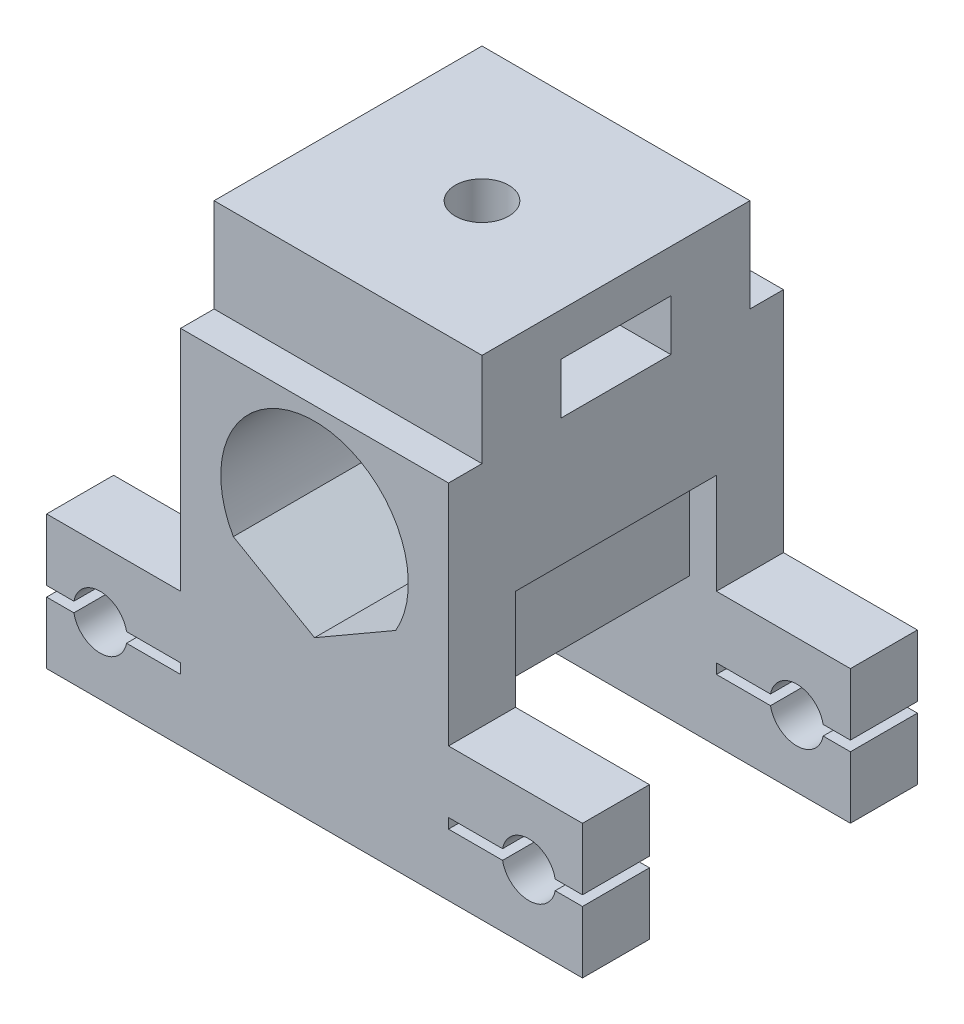
from build123d import *

# Parameters (mm, degrees)
SKETCH1_W               = 20
SKETCH1_H               = 25
BOSS_EXTRUDE1_DEPTH     = 17
CUT_EXTRUDE1_DEPTH      = 32.843366656
BOSS_EXTRUDE2_DEPTH     = 5
SKETCH4_R               = 2
CUT_EXTRUDE2_DEPTH      = 37.249137921
SKETCH6_W               = 20
SKETCH6_H               = 20
BOSS_EXTRUDE3_DEPTH     = 7
SKETCH8_W               = 8.2
SKETCH8_H               = 3.8
CUT_EXTRUDE3_DEPTH      = 41.401113846
CUT_EXTRUDE4_REACH      = 43.379
CUT_EXTRUDE4_END_RADIUS = 7
SKETCH7_R               = 2
SKETCH9_W               = 15
SKETCH9_H               = 7.5
CUT_EXTRUDE5_DEPTH      = 2
SKETCH10_W              = 10
SKETCH10_H              = 0.75
CUT_EXTRUDE6_DEPTH      = 41.01249811


with BuildPart() as part:
    # Sketch1 → Boss-Extrude1 (new body)
    with BuildSketch(Plane(origin=(0, 0, 0), x_dir=(1, 0, 0), z_dir=(0, 1, 0))):
        Rectangle(SKETCH1_W, SKETCH1_H)
    extrude(amount=BOSS_EXTRUDE1_DEPTH)

    # Sketch2 → Cut-Extrude1 (cut, through all)
    with BuildSketch(Plane.XY.offset(12.5)):
        with BuildLine():
            Line((0, 2), (-6.062177826, 5.5))
            ThreePointArc((-6.062177826, 5.5), (0, 16), (6.062177826, 5.5))
            Line((6.062177826, 5.5), (0, 2))
        make_face()
    extrude(amount=-CUT_EXTRUDE1_DEPTH, mode=Mode.SUBTRACT)

    # Sketch3 → Boss-Extrude2 (add)
    with BuildSketch(Plane.XY.offset(12.5)):
        Polygon((10, 0), (20, 0), (20, -10), (-20, -10), (-20, 0), (-10, 0), align=None)
    boss_extrude2 = extrude(amount=-BOSS_EXTRUDE2_DEPTH)

    # Mirror1: Boss-Extrude2 across plane
    add(boss_extrude2.mirror(Plane.XY))

    # Sketch4 → Cut-Extrude2 (cut, through all)
    with BuildSketch(Plane.XY.offset(12.5)):
        with Locations((16, -5)):
            Circle(SKETCH4_R)
        with Locations((-16, -5)):
            Circle(SKETCH4_R)
    extrude(amount=-CUT_EXTRUDE2_DEPTH, mode=Mode.SUBTRACT)

    # Sketch6 → Boss-Extrude3 (add)
    with BuildSketch(Plane(origin=(0, 17, 0), x_dir=(1, 0, 0), z_dir=(0, 1, 0))):
        Rectangle(SKETCH6_W, SKETCH6_H)
    extrude(amount=BOSS_EXTRUDE3_DEPTH)

    # Sketch8 → Cut-Extrude3 (cut, through all)
    with BuildSketch(Plane(origin=(10, 0, 0), x_dir=(0, 0, -1), z_dir=(1, 0, 0))):
        with Locations((0, 18.9)):
            Rectangle(SKETCH8_W, SKETCH8_H)
    extrude(amount=-CUT_EXTRUDE3_DEPTH, mode=Mode.SUBTRACT)

    # Cut-Extrude4: up to this cylinder (the profile starts outside it)
    cut_extrude4_end = Plane(origin=(0, 9, 0), z_dir=(0, 0, 1)) * Cylinder(CUT_EXTRUDE4_END_RADIUS, 101.758, mode=Mode.PRIVATE)
    # Sketch7 → Cut-Extrude4 (cut, up to the surface)
    with BuildSketch(Plane(origin=(0, 24, 0), x_dir=(1, 0, 0), z_dir=(0, 1, 0)), mode=Mode.PRIVATE) as cut_extrude4_sk1:
        Circle(SKETCH7_R)
    cut_extrude4_tool1 = extrude(cut_extrude4_sk1.sketch, amount=-CUT_EXTRUDE4_REACH, mode=Mode.PRIVATE) - cut_extrude4_end
    add(cut_extrude4_tool1.solids().sort_by_distance((0, 24, 0))[0], mode=Mode.SUBTRACT)

    # Sketch9 → Cut-Extrude5 (cut)
    with BuildSketch(Plane.ZY.offset(-10)):
        with Locations((0, 3.75)):
            Rectangle(SKETCH9_W, SKETCH9_H)
    extrude(amount=CUT_EXTRUDE5_DEPTH, mode=Mode.SUBTRACT)

    # Sketch10 → Cut-Extrude6 (cut, through all)
    with BuildSketch(Plane.XY.offset(12.5)):
        with Locations((-15, -5)):
            Rectangle(SKETCH10_W, SKETCH10_H)
        with Locations((15, -5)):
            Rectangle(SKETCH10_W, SKETCH10_H)
    extrude(amount=-CUT_EXTRUDE6_DEPTH, mode=Mode.SUBTRACT)


solid = part.part
